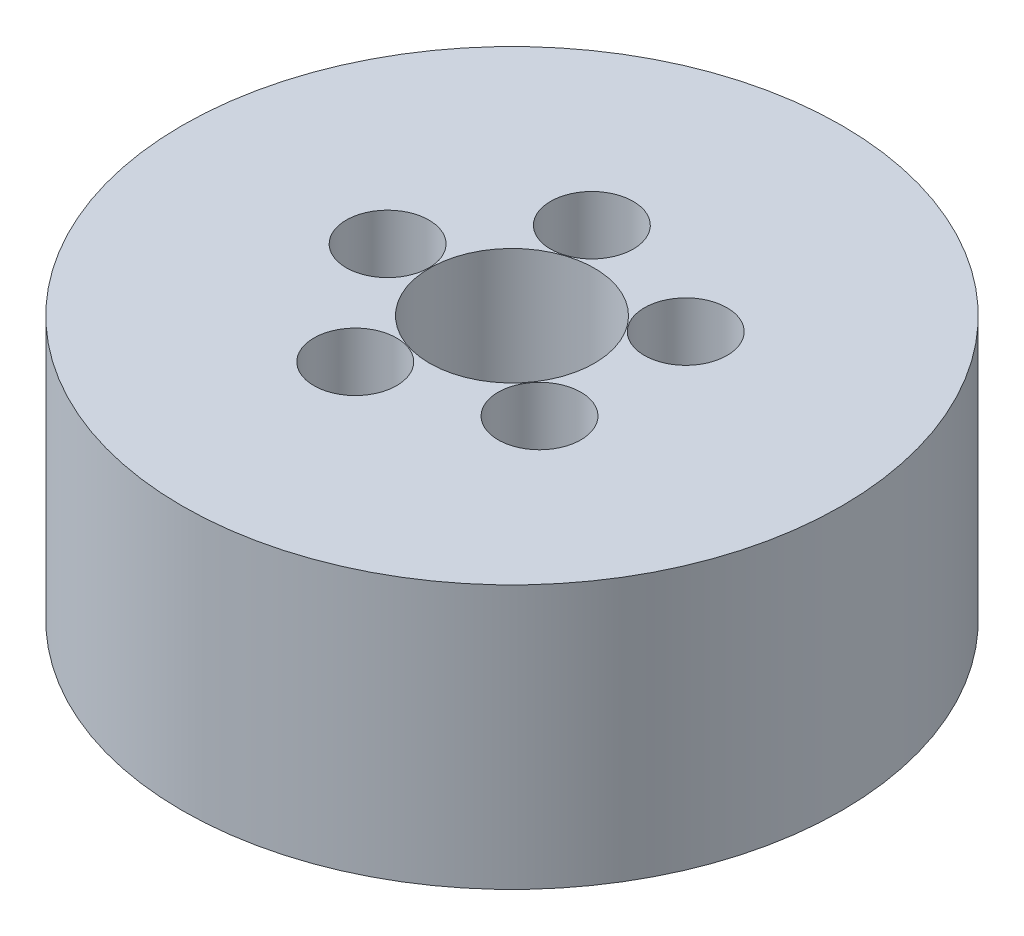
from build123d import *

# Parameters (mm, degrees)
SKETCH1_R           = 20
BOSS_EXTRUDE1_DEPTH = 16
SKETCH2_R           = 5
CUT_EXTRUDE1_DEPTH  = 33.496153619
SKETCH3_R           = 2.508674829
CUT_EXTRUDE2_DEPTH  = 12.156418835
CIRPATTERN1_COUNT   = 5


with BuildPart() as part:
    # Sketch1 → Boss-Extrude1 (new body)
    with BuildSketch(Plane(origin=(0, 0, 0), x_dir=(1, 0, 0), z_dir=(0, 1, 0))):
        Circle(SKETCH1_R)
    extrude(amount=BOSS_EXTRUDE1_DEPTH)

    # Sketch2 → Cut-Extrude1 (cut, through all)
    with BuildSketch(Plane(origin=(0, 0, 0), x_dir=(1, 0, 0), z_dir=(0, 1, 0))):
        Circle(SKETCH2_R)
    extrude(amount=CUT_EXTRUDE1_DEPTH, mode=Mode.SUBTRACT)

    # Sketch3 → Cut-Extrude2 (cut)
    with BuildSketch(Plane(origin=(0, 16, 0), x_dir=(1, 0, 0), z_dir=(0, 1, 0))):
        with Locations((-7.545734143, 0)):
            Circle(SKETCH3_R)
    cut_extrude2 = extrude(amount=-CUT_EXTRUDE2_DEPTH, mode=Mode.SUBTRACT)

    # CirPattern1: Cut-Extrude2 ×5 about axis
    cirpattern1_axis = Axis((0, 0, 0), (0, 1, 0))
    for i in range(1, CIRPATTERN1_COUNT):
        add(cut_extrude2.rotate(cirpattern1_axis, i * 360 / CIRPATTERN1_COUNT), mode=Mode.SUBTRACT)


solid = part.part
